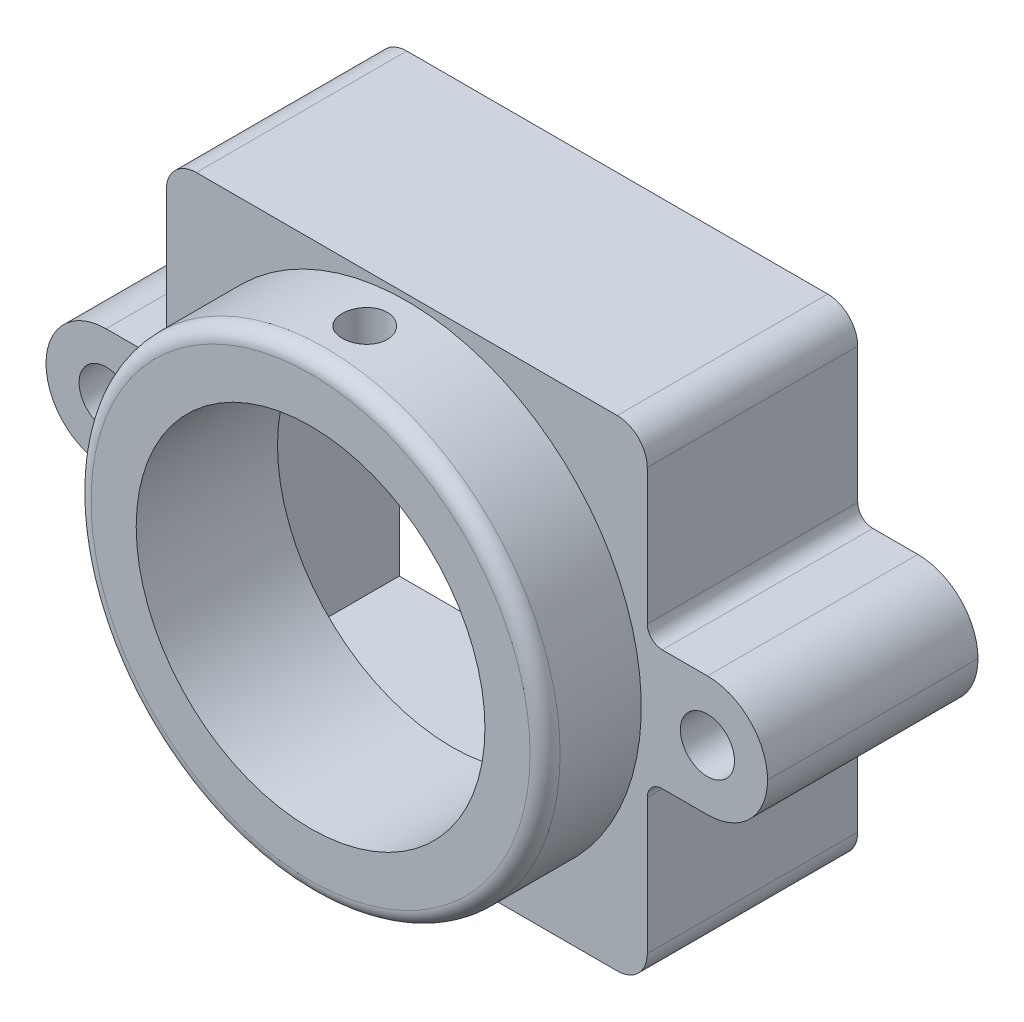
from build123d import *

# Parameters (mm, degrees)
SKETCH1_R           = 0.9
BOSS_EXTRUDE1_DEPTH = 7
FILLET1_R           = 2
FILLET2_R           = 1
FILLET3_R           = 0.5
SKETCH2_W           = 14.5
SKETCH2_H           = 14.5
CUT_EXTRUDE1_DEPTH  = 5.5
SKETCH3_R           = 7.8
BOSS_EXTRUDE2_DEPTH = 3.2
SKETCH5_R           = 0.75
CUT_EXTRUDE2_DEPTH  = 18.664653973
FILLET4_R           = 0.5
SKETCH6_R           = 5.8
CUT_EXTRUDE3_DEPTH  = 18.664653973


with BuildPart() as part:
    # Sketch1 → Boss-Extrude1 (new body)
    with BuildSketch(Plane.XY):
        Polygon((-8, 2), (-8, 8), (8, 8), (8, 2), (12, 2), (12, -2), (8, -2), (8, -8), (-8, -8), (-8, -2), (-12, -2), (-12, 2), align=None)
        with Locations((10, 0)):
            Circle(SKETCH1_R, mode=Mode.SUBTRACT)
        with Locations((-10, 0)):
            Circle(SKETCH1_R, mode=Mode.SUBTRACT)
    extrude(amount=BOSS_EXTRUDE1_DEPTH)

    # Fillet1
    fillet1_edges = [part.edges().sort_by_distance(p)[0] for p in [
        (-12, -2, 3.5),
        (-12, 2, 3.5),
        (12, -2, 3.5),
        (12, 2, 3.5),
    ]]
    fillet(fillet1_edges, radius=FILLET1_R - 0.0001)  # a hair under: the kernel refuses the full size

    # Fillet2
    fillet2_edges = [part.edges().sort_by_distance(p)[0] for p in [
        (8, -8, 3.5),
        (-8, -8, 3.5),
        (-8, 8, 3.5),
        (8, 8, 3.5),
    ]]
    fillet(fillet2_edges, radius=FILLET2_R)

    # Fillet3
    fillet3_edges = [part.edges().sort_by_distance(p)[0] for p in [
        (8, 2, 3.5),
        (8, -2, 3.5),
        (-8, -2, 3.5),
        (-8, 2, 3.5),
    ]]
    fillet(fillet3_edges, radius=FILLET3_R)

    # Sketch2 → Cut-Extrude1 (cut)
    with BuildSketch(Plane(origin=(0, 0, 0), x_dir=(-1, 0, 0), z_dir=(0, 0, -1))):
        Rectangle(SKETCH2_W, SKETCH2_H)
    extrude(amount=-CUT_EXTRUDE1_DEPTH, mode=Mode.SUBTRACT)

    # Sketch3 → Boss-Extrude2 (add)
    with BuildSketch(Plane.XY.offset(7)):
        with Locations(Location((0, 0, 0), (0, 0, 180))):
            Circle(SKETCH3_R)
    extrude(amount=BOSS_EXTRUDE2_DEPTH)

    # Sketch5 → Cut-Extrude2 (cut, through all)
    with BuildSketch(Plane(origin=(0, 0, 0), x_dir=(1, 0, 0), z_dir=(0, 1, 0))):
        with Locations(Location((0, -8.4, 0), (0, 0, 90))):
            Circle(SKETCH5_R)
    extrude(amount=CUT_EXTRUDE2_DEPTH, mode=Mode.SUBTRACT)

    # Fillet4
    fillet4_edges = [part.edges().sort_by_distance(p)[0] for p in [
        (7.8, 0, 10.2),
    ]]
    fillet(fillet4_edges, radius=FILLET4_R)

    # Sketch6 → Cut-Extrude3 (cut, through all)
    with BuildSketch(Plane.XY.offset(10.2)):
        Circle(SKETCH6_R)
    extrude(amount=-CUT_EXTRUDE3_DEPTH, mode=Mode.SUBTRACT)


solid = part.part
